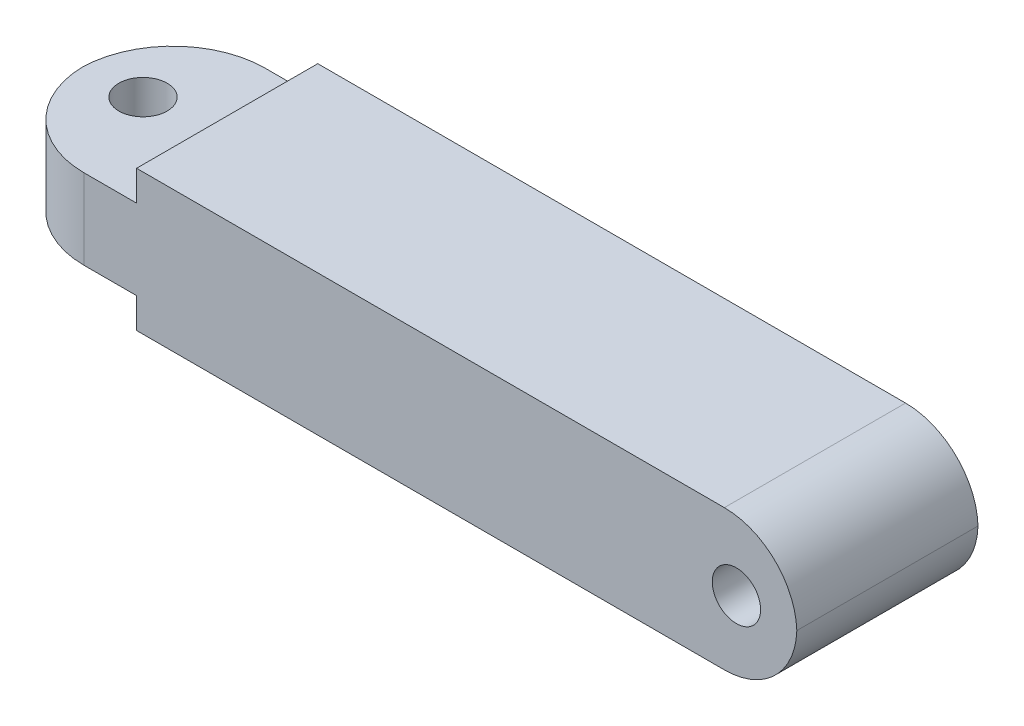
from build123d import *

# Parameters (mm, degrees)
SKETCH1_W           = 200
SKETCH1_H           = 45
BOSS_EXTRUDE1_DEPTH = 17.45
FILLET1_R           = 18
FILLET2_R           = 23
SKETCH2_W           = 40
SKETCH2_H           = 45
CUT_EXTRUDE1_DEPTH  = 7.5
SKETCH3_R           = 6
CUT_EXTRUDE2_DEPTH  = 120.515065654
SKETCH4_R           = 6
CUT_EXTRUDE3_DEPTH  = 124.027462877
SCALE1_SCALE        = 0.31


with BuildPart() as part:
    # Sketch1 → Boss-Extrude1 (new, symmetric)
    with BuildSketch(Plane(origin=(0, 0, 0), x_dir=(1, 0, 0), z_dir=(0, 1, 0))):
        with Locations((13.173125929, -4.459910913)):
            Rectangle(SKETCH1_W, SKETCH1_H)
    extrude(amount=BOSS_EXTRUDE1_DEPTH, both=True)

    # Fillet1
    # the kernel refuses this fillet: 18 mm, written as the material it takes off along each edge
    with BuildSketch(Plane(origin=(113.173125929, -17.45, -63.040089087), x_dir=(0, 1, 0), z_dir=(0, 0, 1)), Plane(origin=(113.173125929, 17.45, -63.040089087), x_dir=(-1, 0, 0), z_dir=(0, 0, 1))) as fillet1_piece_1:
        with BuildLine():
            CenterArc((FILLET1_R, FILLET1_R), FILLET1_R, 180, 90)
            Line((0, FILLET1_R), (0, 0))
            Line((0, 0), (FILLET1_R, 0))
        make_face()
    extrude(amount=135, mode=Mode.SUBTRACT)

    # Fillet2
    # the kernel refuses this fillet: 23 mm, written as the material it takes off along each edge
    with BuildSketch(Plane(origin=(-86.826874071, -74.95, -18.040089087), x_dir=(1, 0, 0), z_dir=(0, 1, 0)), Plane(origin=(-86.826874071, -74.95, 26.959910913), x_dir=(0, 0, -1), z_dir=(0, 1, 0))) as fillet2_piece_1:
        with BuildLine():
            CenterArc((FILLET2_R, -FILLET2_R), FILLET2_R, 90, 90)
            Line((0, -FILLET2_R), (0, 0))
            Line((0, 0), (FILLET2_R, 0))
        make_face()
    extrude(amount=149.9, mode=Mode.SUBTRACT)

    # Sketch2 → Cut-Extrude1 (cut)
    with BuildSketch(Plane(origin=(0, 17.45, 0), x_dir=(1, 0, 0), z_dir=(0, 1, 0))):
        with Locations((-70.821438646, -4.459910913)):
            Rectangle(SKETCH2_W, SKETCH2_H)
    cut_extrude1 = extrude(amount=-CUT_EXTRUDE1_DEPTH, mode=Mode.SUBTRACT)

    # Mirror1: Cut-Extrude1 across plane
    add(cut_extrude1.mirror(Plane.ZX), mode=Mode.SUBTRACT)

    # Sketch3 → Cut-Extrude2 (cut, through all)
    with BuildSketch(Plane(origin=(0, 9.95, 0), x_dir=(1, 0, 0), z_dir=(0, 1, 0))):
        with Locations(Location((-72.821438646, -3.356394194, 0), (0, 0, 270))):
            Circle(SKETCH3_R)
    extrude(amount=-CUT_EXTRUDE2_DEPTH, mode=Mode.SUBTRACT)

    # Sketch4 → Cut-Extrude3 (cut, through all)
    with BuildSketch(Plane.XY.offset(26.959910913)):
        with Locations((98.164721189, 0)):
            Circle(SKETCH4_R)
    extrude(amount=-CUT_EXTRUDE3_DEPTH, mode=Mode.SUBTRACT)


with BuildPart() as part_1:
    # Scale1: scaled about (0, 0, 0)
    add(part.part.scale(SCALE1_SCALE))


solid = part_1.part
